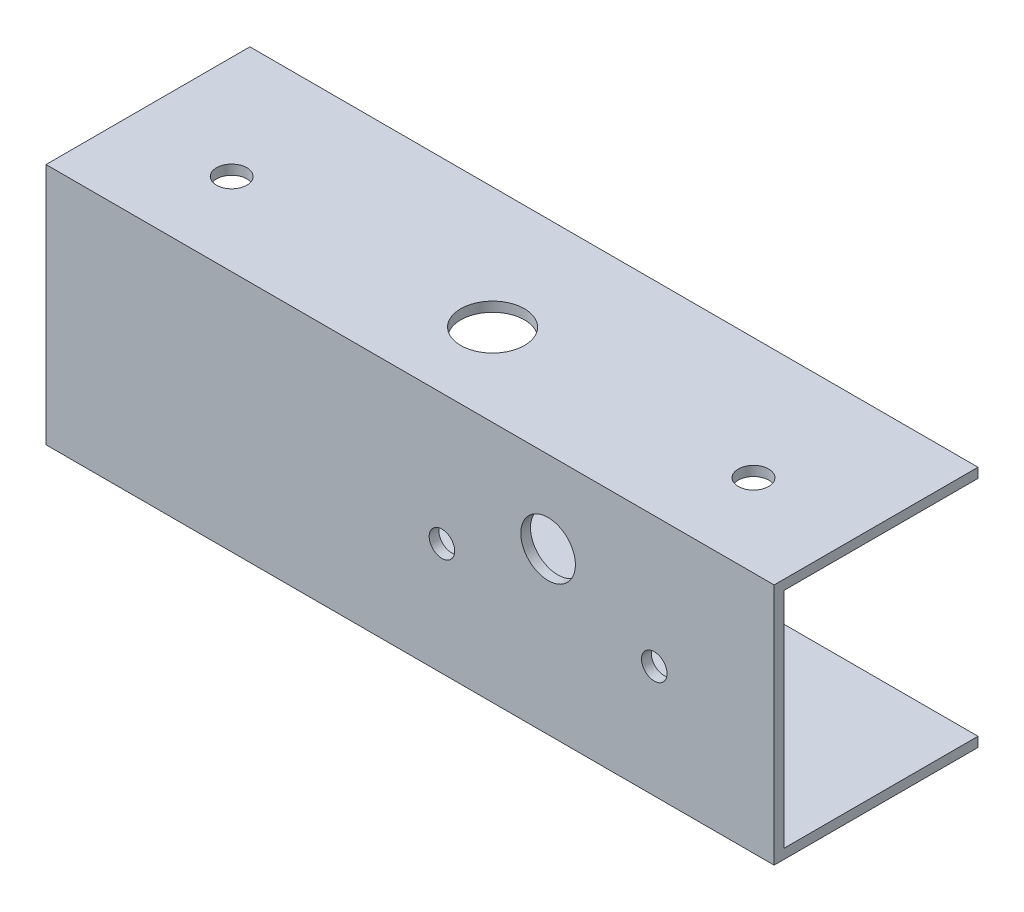
from build123d import *

# Parameters (mm, degrees)
SKETCH1_W           = 120
SKETCH1_H           = 32
SKETCH1_R           = 5.25
SKETCH1_R_2         = 2.5
BOSS_EXTRUDE1_DEPTH = 1.6
SKETCH3_W           = 120
SKETCH3_H           = 1.6
BOSS_EXTRUDE3_DEPTH = 40
SKETCH4_R           = 2.1
SKETCH4_R_2         = 4.5
CUT_EXTRUDE1_DEPTH  = 2


with BuildPart() as part:
    # Sketch1 → Boss-Extrude1 (new body)
    with BuildSketch(Plane(origin=(0, 0, 0), x_dir=(1, 0, 0), z_dir=(0, 1, 0))):
        with Locations((0, 4)):
            Rectangle(SKETCH1_W, SKETCH1_H)
        Circle(SKETCH1_R, mode=Mode.SUBTRACT)
        with Locations((-43, 0)):
            Circle(SKETCH1_R_2, mode=Mode.SUBTRACT)
        with Locations((43, 0)):
            Circle(SKETCH1_R_2, mode=Mode.SUBTRACT)
    boss_extrude1 = extrude(amount=BOSS_EXTRUDE1_DEPTH)

    # Sketch3 → Boss-Extrude3 (add)
    with BuildSketch(Plane.XZ):
        with Locations((0, 12.8)):
            Rectangle(SKETCH3_W, SKETCH3_H)
    extrude(amount=-BOSS_EXTRUDE3_DEPTH)

    # Mirror1: Boss-Extrude1 across plane
    add(boss_extrude1.mirror(Plane.ZX.offset(20)))

    # Sketch4 → Cut-Extrude1 (cut)
    with BuildSketch(Plane.XY.offset(13.6)):
        with Locations((5.25, 18.5)):
            Circle(SKETCH4_R)
        with Locations((22.75, 26.5)):
            Circle(SKETCH4_R_2)
        with Locations((40.25, 18.5)):
            Circle(SKETCH4_R)
    extrude(amount=-CUT_EXTRUDE1_DEPTH, mode=Mode.SUBTRACT)


solid = part.part
